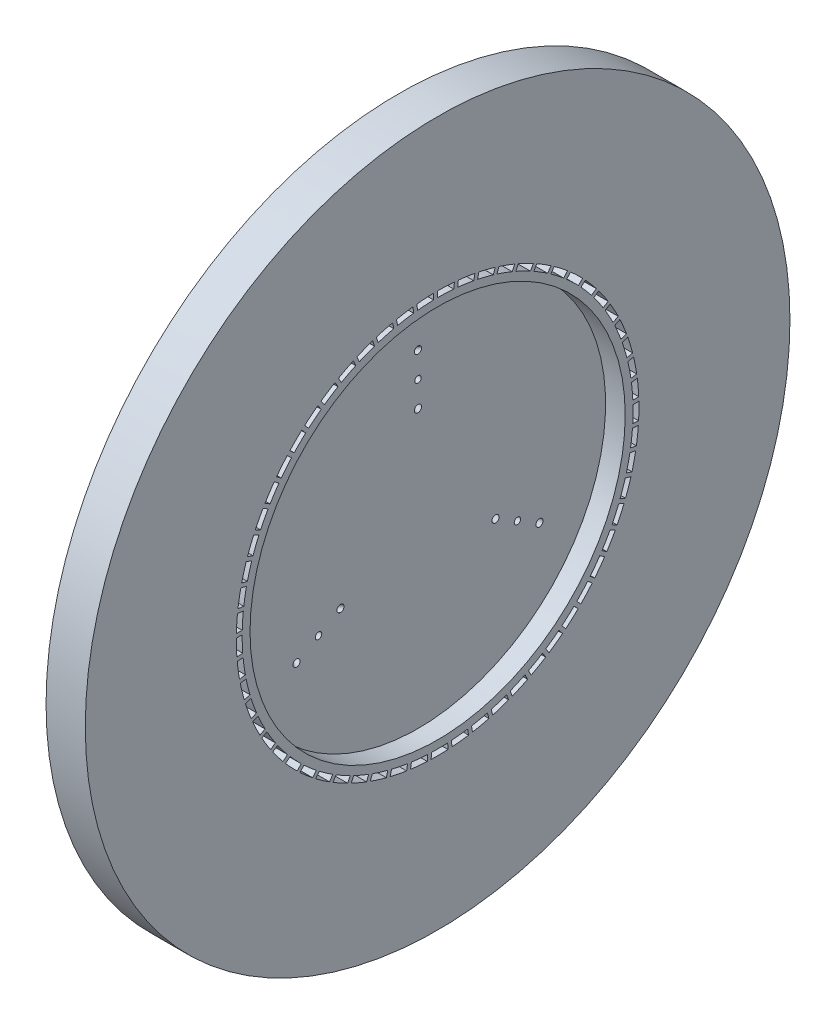
from build123d import *

# Parameters (mm, degrees)
SKETCH1_R                                = 89.825
SKETCH1_R_2                              = 47.825
FLANGE_DEPTH                             = 10
REGEN_SLOTS_DEPTH                        = 25
FACEPLATE_EXTRUSION_TO_MANIFOLD_SKETCH_R = 47.825
FACEPLATE_EXTRUSION_TO_MANIFOLD_DEPTH    = 5
FACEPLATE_START                          = 1
FACEPLATE_EXTRUSION_TO_CHAMBER_SKETCH_R  = 47.825
FACEPLATE_EXTRUSION_TO_CHAMBER_DEPTH     = 1
O_RING_SLOT_SKETCH_R                     = 47.825
O_RING_SLOT_SKETCH_R_2                   = 44.825
O_RING_SLOT_DEPTH                        = 2.5
FUEL_ORIFICES_SKETCH_R                   = 0.826210335
FUEL_ORIFICES_DEPTH                      = 128.507102743
OX1_PROFILE_R                            = 0.914623685
REVOLVE_OX_ORIFICE_1_COUNT               = 3
OX2_PROFILE_R                            = 0.914623685
REVOLVE_OX_ORIFICE_2_COUNT               = 3


with BuildPart() as part:
    # Sketch1 → Flange (new body)
    with BuildSketch(Plane(origin=(0, 0, 0), x_dir=(0, 0, -1), z_dir=(1, 0, 0))):
        Circle(SKETCH1_R)
        Circle(SKETCH1_R_2, mode=Mode.SUBTRACT)
    extrude(amount=FLANGE_DEPTH)

    # Regen Slots Sketch → Regen Slots (cut)
    with BuildSketch(Plane(origin=(10, 0, 0), x_dir=(0, 0, -1), z_dir=(1, 0, 0))):
        with BuildLine():
            ThreePointArc((-19.952615849, 45.655489766), (-18.042869594, 46.443357779), (-16.102104764, 47.15138224))
            Line((-16.102104764, 47.15138224), (-16.55836623, 48.580614784))
            ThreePointArc((-16.55836623, 48.580614784), (-18.57202224, 47.847002152), (-20.553296708, 47.029965123))
            Line((-20.553296708, 47.029965123), (-19.952615849, 45.655489766))
        make_face()
        with BuildLine():
            ThreePointArc((-15.152521521, 47.465057849), (-13.171887784, 48.052388049), (-11.168609468, 48.557108517))
            Line((-11.168609468, 48.557108517), (-11.475497576, 50.02567921))
            ThreePointArc((-11.475497576, 50.02567921), (-13.553911741, 49.503000934), (-15.608693769, 48.89401092))
            Line((-15.608693769, 48.89401092), (-15.152521521, 47.465057849))
        make_face()
        with BuildLine():
            ThreePointArc((-10.191806695, 48.77148451), (-8.161280686, 49.152051051), (-6.116724133, 49.448117364))
            Line((-6.116724133, 49.448117364), (-6.270985793, 50.940458991))
            ThreePointArc((-6.270985793, 50.940458991), (-8.392126406, 50.634255592), (-10.498634794, 50.239768038))
            Line((-10.498634794, 50.239768038), (-10.191806695, 48.77148451))
        make_face()
        with BuildLine():
            ThreePointArc((-5.123056182, 49.560921302), (-3.064161983, 49.730690085), (-1, 49.814963866))
            Line((-1, 49.814963866), (-1, 51.315257234))
            ThreePointArc((-1, 51.315257234), (-3.141382443, 51.228774545), (-5.277287678, 51.052971116))
            Line((-5.277287678, 51.052971116), (-5.123056182, 49.560921302))
        make_face()
        with BuildLine():
            Line((0, 51.325), (0, 49.825))
            ThreePointArc((0, 49.825), (2.065437599, 49.782171432), (4.127324381, 49.653759359))
            Line((4.127324381, 49.653759359), (4.281586042, 51.146100985))
            ThreePointArc((4.281586042, 51.146100985), (2.142660956, 51.280255743), (0, 51.325))
        make_face()
        with BuildLine():
            Line((5.277287678, 51.052971116), (5.123056182, 49.560921302))
            ThreePointArc((5.123056182, 49.560921302), (7.17314303, 49.305949378), (9.210898098, 48.966212649))
            Line((9.210898098, 48.966212649), (9.517786206, 50.434783342))
            ThreePointArc((9.517786206, 50.434783342), (7.403991615, 50.788153473), (5.277287678, 51.052971116))
        make_face()
        with BuildLine():
            Line((10.498634794, 50.239768038), (10.191806695, 48.77148451))
            ThreePointArc((10.191806695, 48.77148451), (12.204811359, 48.307071995), (14.196834003, 47.759611905))
            Line((14.196834003, 47.759611905), (14.653095469, 49.188844449))
            ThreePointArc((14.653095469, 49.188844449), (12.586838122, 49.757684141), (10.498634794, 50.239768038))
        make_face()
        with BuildLine():
            Line((15.608693769, 48.89401092), (15.152521521, 47.465057849))
            ThreePointArc((15.152521521, 47.465057849), (17.107105652, 46.79612763), (19.032279936, 46.046747393))
            Line((19.032279936, 46.046747393), (19.633078274, 47.421491567))
            ThreePointArc((19.633078274, 47.421491567), (17.636261013, 48.19977098), (15.608693769, 48.89401092))
        make_face()
        with BuildLine():
            Line((20.553296708, 47.029965123), (19.952615849, 45.655489766))
            ThreePointArc((19.952615849, 45.655489766), (21.828060369, 44.789132672), (23.665978967, 43.845775903))
            Line((23.665978967, 43.845775903), (24.404945566, 45.151459078))
            ThreePointArc((24.404945566, 45.151459078), (22.498735149, 46.130928255), (20.553296708, 47.029965123))
        make_face()
        with BuildLine():
            Line((25.280029588, 44.667389996), (24.541207486, 43.361962134))
            ThreePointArc((24.541207486, 43.361962134), (26.317632217, 42.307361765), (28.048812733, 41.180028282))
            Line((28.048812733, 41.180028282), (28.918114364, 42.402809891))
            ThreePointArc((28.918114364, 42.402809891), (27.122717097, 43.573086215), (25.280029588, 44.667389996))
        make_face()
        with BuildLine():
            Line((29.738787865, 41.831329423), (28.869656218, 40.608786917))
            ThreePointArc((28.869656218, 40.608786917), (30.528230615, 39.377122298), (32.134322107, 38.077762116))
            Line((32.134322107, 38.077762116), (33.124743955, 39.20468037))
            ThreePointArc((33.124743955, 39.20468037), (31.459191495, 40.553358621), (29.738787865, 41.831329423))
        make_face()
        with BuildLine():
            Line((33.882307593, 38.551846352), (32.892079412, 37.425148456))
            ThreePointArc((32.892079412, 37.425148456), (34.415222175, 36.02947554), (35.879199672, 34.571862199))
            Line((35.879199672, 34.571862199), (36.98024302, 35.590971484))
            ThreePointArc((36.98024302, 35.590971484), (35.462190638, 37.103755338), (33.882307593, 38.551846352))
        make_face()
        with BuildLine():
            Line((37.666666432, 34.863704119), (36.565838382, 33.844794111))
            ThreePointArc((36.565838382, 33.844794111), (37.937403818, 32.299907377), (39.243748795, 30.699491942))
            Line((39.243748795, 30.699491942), (40.443742309, 31.599989447))
            ThreePointArc((40.443742309, 31.599989447), (39.089281738, 33.260843017), (37.666666432, 34.863704119))
        make_face()
        with BuildLine():
            Line((41.051749236, 30.805997949), (39.851990369, 29.905676528))
            ThreePointArc((39.851990369, 29.905676528), (41.057439543, 28.227952161), (42.192304418, 26.501699434))
            Line((42.192304418, 26.501699434), (43.478527869, 27.27403966))
            ThreePointArc((43.478527869, 27.27403966), (42.302016727, 29.065357486), (41.051749236, 30.805997949))
        make_face()
        with BuildLine():
            Line((44.001673286, 26.421740537), (42.715701344, 25.649551335))
            ThreePointArc((42.715701344, 25.649551335), (43.742256194, 23.85677363), (44.693611118, 22.022982319))
            Line((44.693611118, 22.022982319), (46.052430217, 22.658978268))
            ThreePointArc((46.052430217, 22.658978268), (45.066339816, 24.561771935), (44.001673286, 26.421740537))
        make_face()
        with BuildLine():
            Line((46.485168653, 21.757406103), (45.126615258, 21.121534517))
            ThreePointArc((45.126615258, 21.121534517), (45.963394049, 19.232707363), (46.721154422, 17.310816112))
            Line((46.721154422, 17.310816112), (48.138165348, 17.803726069))
            ThreePointArc((48.138165348, 17.803726069), (47.352948491, 19.797825492), (46.485168653, 21.757406103))
        make_face()
        with BuildLine():
            Line((48.475909667, 16.862437752), (47.059175824, 16.369624179))
            ThreePointArc((47.059175824, 16.369624179), (47.697308492, 14.404769614), (48.253441866, 12.415150949))
            Line((48.253441866, 12.415150949), (49.713623951, 12.759749945))
            ThreePointArc((49.713623951, 12.759749945), (49.137604132, 14.824017173), (48.475909667, 16.862437752))
        make_face()
        with BuildLine():
            Line((49.95279398, 11.788723365), (48.49289742, 11.444191752))
            ThreePointArc((48.49289742, 11.444191752), (48.925619599, 9.424137723), (49.274230822, 7.387882096))
            Line((49.274230822, 7.387882096), (50.762105773, 7.580517297))
            ThreePointArc((50.762105773, 7.580517297), (50.401388946, 9.693070584), (49.95279398, 11.788723365))
        make_face()
        with BuildLine():
            Line((50.90016625, 6.590045578), (49.412582239, 6.397448045))
            ThreePointArc((49.412582239, 6.397448045), (49.635306968, 4.343607628), (49.772700674, 2.282299856))
            Line((49.772700674, 2.282299856), (51.272496646, 2.32092928))
            ThreePointArc((51.272496646, 2.32092928), (51.130906498, 4.459375036), (50.90016625, 6.590045578))
        make_face()
        with BuildLine():
            Line((51.307984095, 1.321511668), (49.808481394, 1.282889798))
            ThreePointArc((49.808481394, 1.282889798), (49.820870177, 0.64149807), (49.825, 0))
            ThreePointArc((49.825, 0), (49.804637718, -1.424319751), (49.743567516, -2.847475331))
            Line((49.743567516, -2.847475331), (51.239386299, -2.963261165))
            ThreePointArc((51.239386299, -2.963261165), (51.30359211, -1.482248835), (51.325, 0))
            ThreePointArc((51.325, 0), (51.320745847, 0.660810606), (51.307984095, 1.321511668))
        make_face()
        with BuildLine():
            Line((51.171924545, -3.961030594), (49.676398255, -3.8452674))
            ThreePointArc((49.676398255, -3.8452674), (49.474296322, -5.901239572), (49.187140168, -7.947066571))
            Line((49.187140168, -7.947066571), (50.66312571, -8.216040304))
            ThreePointArc((50.66312571, -8.216040304), (50.961952887, -6.093847961), (51.171924545, -3.961030594))
        make_face()
        with BuildLine():
            Line((50.493429865, -9.201584946), (49.017732937, -8.932663808))
            ThreePointArc((49.017732937, -8.932663808), (48.60530506, -10.956958749), (48.109316898, -12.962416928))
            Line((48.109316898, -12.962416928), (49.549823386, -13.381727372))
            ThreePointArc((49.549823386, -13.381727372), (50.065272674, -11.301508621), (50.493429865, -9.201584946))
        make_face()
        with BuildLine():
            Line((49.279692266, -14.344600209), (47.839467456, -13.925371756))
            ThreePointArc((47.839467456, -13.925371756), (47.221085473, -15.896531437), (46.521522901, -17.840362441))
            Line((46.521522901, -17.840362441), (47.911280607, -18.405564801))
            ThreePointArc((47.911280607, -18.405564801), (48.637888116, -16.389370478), (49.279692266, -14.344600209))
        make_face()
        with BuildLine():
            Line((47.543577671, -19.335559141), (46.154091718, -18.7704673))
            ThreePointArc((46.154091718, -18.7704673), (45.336310633, -20.667596938), (44.440589187, -22.529195674))
            Line((44.440589187, -22.529195674), (45.764866334, -23.234298664))
            ThreePointArc((45.764866334, -23.234298664), (46.694929844, -21.30350093), (47.543577671, -19.335559141))
        make_face()
        with BuildLine():
            Line((45.303489324, -24.121556336), (43.979471127, -23.416591221))
            ThreePointArc((43.979471127, -23.416591221), (42.970959622, -25.219580769), (41.888574173, -26.979213828))
            Line((41.888574173, -26.979213828), (43.133333094, -27.816743182))
            ThreePointArc((43.133333094, -27.816743182), (44.256993699, -25.991808973), (45.303489324, -24.121556336))
        make_face()
        with BuildLine():
            Line((42.583172721, -28.651859033), (41.3386572, -27.81449345))
            ThreePointArc((41.3386572, -27.81449345), (40.150105749, -29.50423077), (38.892529852, -31.143245604))
            Line((38.892529852, -31.143245604), (40.044575792, -32.104323301))
            ThreePointArc((40.044575792, -32.104323301), (41.349922412, -30.404597375), (42.583172721, -28.651859033))
        make_face()
        with BuildLine():
            Line((39.411463893, -32.878444897), (38.259643224, -31.917555129))
            ThreePointArc((38.259643224, -31.917555129), (36.903650767, -33.476128585), (35.484215039, -34.977151229))
            Line((35.484215039, -34.977151229), (36.531336025, -36.051589607))
            ThreePointArc((36.531336025, -36.051589607), (38.00453166, -34.495089481), (39.411463893, -32.878444897))
        make_face()
        with BuildLine():
            Line((35.821983743, -36.756511065), (34.775067511, -35.682282783))
            ThreePointArc((34.775067511, -35.682282783), (33.266007906, -37.09317111), (31.699758719, -38.44029035))
            Line((31.699758719, -38.44029035), (32.630855008, -39.616700095))
            ThreePointArc((32.630855008, -39.616700095), (34.256283418, -38.219925057), (35.821983743, -36.756511065))
        make_face()
        with BuildLine():
            Line((31.852781655, -40.244949073), (30.921867432, -39.068769363))
            ThreePointArc((30.921867432, -39.068769363), (29.275737086, -40.317016793), (27.579277071, -41.49595283))
            Line((27.579277071, -41.49595283), (28.384478811, -42.761863706))
            ThreePointArc((28.384478811, -42.761863706), (30.14491005, -41.53961992), (31.852781655, -40.244949073))
        make_face()
        with BuildLine():
            Line((27.545932157, -43.306780608), (26.740887866, -42.041117268))
            ThreePointArc((26.740887866, -42.041117268), (24.97513617, -43.113492068), (23.166448225, -44.111747887))
            Line((23.166448225, -44.111747887), (23.837220077, -45.453740924))
            ThreePointArc((23.837220077, -45.453740924), (25.713993136, -44.418984477), (27.545932157, -43.306780608))
        make_face()
        with BuildLine():
            Line((22.947088925, -45.909549495), (22.276448235, -44.567818872))
            ThreePointArc((22.276448235, -44.567818872), (20.409792597, -45.452953602), (18.508049264, -46.259947443))
            Line((18.508049264, -46.259947443), (19.03728088, -47.663797181))
            ThreePointArc((19.03728088, -47.663797181), (21.010501499, -46.827496749), (22.947088925, -45.909549495))
        make_face()
        with BuildLine():
            Line((18.105000842, -48.025665737), (17.575872712, -46.622090509))
            ThreePointArc((17.575872712, -46.622090509), (15.628100145, -47.31060252), (13.653460377, -47.917780048))
            Line((13.653460377, -47.917780048), (14.03554177, -49.36860533))
            ThreePointArc((14.03554177, -49.36860533), (16.084293318, -48.739625906), (18.105000842, -48.025665737))
        make_face()
        with BuildLine():
            Line((13.070995246, -49.632697975), (12.688988566, -48.182156388))
            ThreePointArc((12.688988566, -48.182156388), (10.680745944, -48.666747283), (8.654141414, -49.067672264))
            Line((8.654141414, -49.067672264), (8.885022426, -50.550093981))
            ThreePointArc((8.885022426, -50.550093981), (10.987587627, -50.135102903), (13.070995246, -49.632697975))
        make_face()
        with BuildLine():
            Line((7.898433849, -50.713611267), (7.667597984, -49.231479423))
            ThreePointArc((7.667597984, -49.231479423), (5.620173179, -49.507012417), (3.563086399, -49.697434947))
            Line((3.563086399, -49.697434947), (3.640319633, -51.195739061))
            ThreePointArc((3.640319633, -51.195739061), (5.774410774, -50.999135338), (7.898433849, -50.713611267))
        make_face()
        with BuildLine():
            Line((2.642147089, -51.256947663), (2.564928956, -49.758936529))
            ThreePointArc((2.564928956, -49.758936529), (0.50002518, -49.822490903), (-1.565738219, -49.800392457))
            Line((-1.565738219, -49.800392457), (-1.642971453, -51.29869657))
            ThreePointArc((-1.642971453, -51.29869657), (0.50002373, -51.322564251), (2.642147089, -51.256947663))
        make_face()
        with BuildLine():
            ThreePointArc((-2.564928956, -49.758936529), (-4.62542321, -49.609838592), (-6.677965622, -49.375453417))
            Line((-6.677965622, -49.375453417), (-6.908846633, -50.857875135))
            ThreePointArc((-6.908846633, -50.857875135), (-4.77966369, -51.101961215), (-2.642147089, -51.256947663))
            Line((-2.642147089, -51.256947663), (-2.564928956, -49.758936529))
        make_face()
        with BuildLine():
            ThreePointArc((-7.667597984, -49.231479423), (-9.701840963, -48.87130965), (-11.719404928, -48.427122288))
            Line((-11.719404928, -48.427122288), (-12.10148632, -49.87794757))
            ThreePointArc((-12.10148632, -49.87794757), (-10.008685486, -50.339664678), (-7.898433849, -50.713611267))
            Line((-7.898433849, -50.713611267), (-7.667597984, -49.231479423))
        make_face()
        with BuildLine():
            ThreePointArc((-12.688988566, -48.182156388), (-14.675416789, -47.614732668), (-16.636615626, -46.965451616))
            Line((-16.636615626, -46.965451616), (-17.165847242, -48.369301354))
            ThreePointArc((-17.165847242, -48.369301354), (-15.131612725, -49.043755172), (-13.070995246, -49.632697975))
            Line((-13.070995246, -49.632697975), (-12.688988566, -48.182156388))
        make_face()
        with BuildLine():
            ThreePointArc((-17.575872712, -46.622090509), (-19.493429546, -45.853427675), (-21.37747406, -45.005935473))
            Line((-21.37747406, -45.005935473), (-22.048245913, -46.34792851))
            ThreePointArc((-22.048245913, -46.34792851), (-20.094141106, -47.22796966), (-18.105000842, -48.025665737))
            Line((-18.105000842, -48.025665737), (-17.575872712, -46.622090509))
        make_face()
        with BuildLine():
            ThreePointArc((-22.276448235, -44.567818872), (-24.104807101, -43.606064941), (-25.891725951, -42.569345218))
            Line((-25.891725951, -42.569345218), (-26.696927691, -43.835256094))
            ThreePointArc((-26.696927691, -43.835256094), (-24.843666592, -44.911555921), (-22.947088925, -45.909549495))
            Line((-22.947088925, -45.909549495), (-22.276448235, -44.567818872))
        make_face()
        with BuildLine():
            ThreePointArc((-26.740887866, -42.041117268), (-28.460667703, -40.896467071), (-30.131519106, -39.681509313))
            Line((-30.131519106, -39.681509313), (-31.062615395, -40.857919059))
            ThreePointArc((-31.062615395, -40.857919059), (-29.329843032, -42.119068517), (-27.545932157, -43.306780608))
            Line((-27.545932157, -43.306780608), (-26.740887866, -42.041117268))
        make_face()
        with BuildLine():
            ThreePointArc((-30.921867432, -39.068769363), (-32.514838148, -37.753356476), (-34.051910662, -36.373039538))
            Line((-34.051910662, -36.373039538), (-35.099031649, -37.447477917))
            ThreePointArc((-35.099031649, -37.447477917), (-33.505115839, -38.880108508), (-31.852781655, -40.244949073))
            Line((-31.852781655, -40.244949073), (-30.921867432, -39.068769363))
        make_face()
        with BuildLine():
            ThreePointArc((-34.775067511, -35.682282783), (-36.224343219, -34.210050911), (-37.611343494, -32.679006496))
            Line((-37.611343494, -32.679006496), (-38.763389435, -33.640084193))
            ThreePointArc((-38.763389435, -33.640084193), (-37.325226083, -35.229009678), (-35.821983743, -36.756511065))
            Line((-35.821983743, -36.756511065), (-34.775067511, -35.682282783))
        make_face()
        with BuildLine():
            ThreePointArc((-38.259643224, -31.917555129), (-39.549861241, -30.304110295), (-40.772086729, -28.638567855))
            Line((-40.772086729, -28.638567855), (-42.01684565, -29.476097209))
            ThreePointArc((-42.01684565, -29.476097209), (-40.749679645, -31.20447458), (-39.411463893, -32.878444897))
            Line((-39.411463893, -32.878444897), (-38.259643224, -31.917555129))
        make_face()
        with BuildLine():
            ThreePointArc((-41.3386572, -27.81449345), (-42.456140895, -26.076938572), (-43.500635701, -24.29455327))
            Line((-43.500635701, -24.29455327), (-44.824912848, -24.999656261))
            ThreePointArc((-44.824912848, -24.999656261), (-43.742176466, -26.849164289), (-42.583172721, -28.651859033))
            Line((-42.583172721, -28.651859033), (-41.3386572, -27.81449345))
        make_face()
        with BuildLine():
            ThreePointArc((-43.979471127, -23.416591221), (-44.912374894, -21.573344812), (-45.768067113, -19.693010377))
            Line((-45.768067113, -19.693010377), (-47.157824819, -20.258212737))
            ThreePointArc((-47.157824819, -20.258212737), (-46.270995334, -22.209246178), (-45.303489324, -24.121556336))
            Line((-45.303489324, -24.121556336), (-43.979471127, -23.416591221))
        make_face()
        with BuildLine():
            ThreePointArc((-46.154091718, -18.7704673), (-46.892526546, -16.841068231), (-47.550345628, -14.882716675))
            Line((-47.550345628, -14.882716675), (-48.990852116, -15.302027119))
            ThreePointArc((-48.990852116, -15.302027119), (-48.309330141, -17.333904532), (-47.543577671, -19.335559141))
            Line((-47.543577671, -19.335559141), (-46.154091718, -18.7704673))
        make_face()
        with BuildLine():
            ThreePointArc((-47.839467456, -13.925371756), (-48.375605751, -11.930272137), (-48.828578651, -9.914662474))
            Line((-48.828578651, -9.914662474), (-50.304564193, -10.183636207))
            ThreePointArc((-50.304564193, -10.183636207), (-49.835574031, -12.274819185), (-49.279692266, -14.344600209))
            Line((-49.279692266, -14.344600209), (-47.839467456, -13.925371756))
        make_face()
        with BuildLine():
            ThreePointArc((-49.017732937, -8.932663808), (-49.3458915, -6.89301219), (-49.589216592, -4.841510384))
            Line((-49.589216592, -4.841510384), (-51.085035374, -4.957296218))
            ThreePointArc((-51.085035374, -4.957296218), (-50.833548438, -7.085617702), (-50.493429865, -9.201584946))
            Line((-50.493429865, -9.201584946), (-49.017732937, -8.932663808))
        make_face()
        with BuildLine():
            ThreePointArc((-49.676398255, -3.8452674), (-49.793098524, -1.7826846), (-49.824196501, 0.282962921))
            Line((-49.824196501, 0.282962921), (-51.323992473, 0.321592345))
            ThreePointArc((-51.323992473, 0.321592345), (-51.292674586, -1.821306909), (-51.171924545, -3.961030594))
            Line((-51.171924545, -3.961030594), (-49.676398255, -3.8452674))
        make_face()
        with BuildLine():
            ThreePointArc((-49.808481394, 1.282889798), (-49.712486316, 3.346539891), (-49.531027533, 5.404436748))
            Line((-49.531027533, 5.404436748), (-51.018902483, 5.597071949))
            ThreePointArc((-51.018902483, 5.597071949), (-51.208085623, 3.462310191), (-51.307984095, 1.321511668))
            Line((-51.307984095, 1.321511668), (-49.808481394, 1.282889798))
        make_face()
        with BuildLine():
            ThreePointArc((-49.412582239, 6.397448045), (-49.104909387, 8.440290227), (-48.71281735, 10.468622201))
            Line((-48.71281735, 10.468622201), (-50.172999435, 10.813221197))
            ThreePointArc((-50.172999435, 10.813221197), (-50.580678213, 8.709225942), (-50.90016625, 6.590045578))
            Line((-50.90016625, 6.590045578), (-49.412582239, 6.397448045))
        make_face()
        with BuildLine():
            ThreePointArc((-48.49289742, 11.444191752), (-47.976808202, 13.444571386), (-47.378239186, 15.421837655))
            Line((-47.378239186, 15.421837655), (-48.795250112, 15.914747611))
            ThreePointArc((-48.795250112, 15.914747611), (-49.417103031, 13.863821731), (-49.95279398, 11.788723365))
            Line((-49.95279398, 11.788723365), (-48.49289742, 11.444191752))
        make_face()
        with BuildLine():
            ThreePointArc((-47.059175824, 16.369624179), (-46.340140915, 18.306336744), (-45.5414399, 20.211577793))
            Line((-45.5414399, 20.211577793), (-46.900258998, 20.847573741))
            ThreePointArc((-46.900258998, 20.847573741), (-47.729694264, 18.871457561), (-48.475909667, 16.862437752))
            Line((-48.475909667, 16.862437752), (-47.059175824, 16.369624179))
        make_face()
        with BuildLine():
            ThreePointArc((-45.126615258, 21.121534517), (-44.212256606, 22.974050379), (-43.221890021, 24.787070178))
            Line((-43.221890021, 24.787070178), (-44.508113472, 25.559410404))
            ThreePointArc((-44.508113472, 25.559410404), (-45.536338864, 23.679051245), (-46.485168653, 21.757406103))
            Line((-46.485168653, 21.757406103), (-45.126615258, 21.121534517))
        make_face()
        with BuildLine():
            ThreePointArc((-39.851990369, 29.905676528), (-38.578029257, 31.53198826), (-37.23774635, 33.104091466))
            Line((-37.23774635, 33.104091466), (-38.338789698, 34.123200751))
            ThreePointArc((-38.338789698, 34.123200751), (-39.729905319, 32.492926128), (-41.051749236, 30.805997949))
            Line((-41.051749236, 30.805997949), (-39.851990369, 29.905676528))
        make_face()
        with BuildLine():
            ThreePointArc((-36.565838382, 33.844794111), (-35.131410429, 35.331496236), (-33.636585968, 36.757457874))
            Line((-33.636585968, 36.757457874), (-34.627007817, 37.884376129))
            ThreePointArc((-34.627007817, 37.884376129), (-36.178376815, 36.405778059), (-37.666666432, 34.863704119))
            Line((-37.666666432, 34.863704119), (-36.565838382, 33.844794111))
        make_face()
        with BuildLine():
            ThreePointArc((-32.892079412, 37.425148456), (-31.312389911, 38.756481562), (-29.678869408, 40.021186085))
            Line((-29.678869408, 40.021186085), (-30.548171039, 41.243967695))
            ThreePointArc((-30.548171039, 41.243967695), (-32.243348516, 39.932719685), (-33.882307593, 38.551846352))
            Line((-33.882307593, 38.551846352), (-32.892079412, 37.425148456))
        make_face()
        with BuildLine():
            ThreePointArc((-28.869656218, 40.608786917), (-27.16145027, 41.770638543), (-25.406549449, 42.860679767))
            Line((-25.406549449, 42.860679767), (-26.145516048, 44.166362943))
            ThreePointArc((-26.145516048, 44.166362943), (-27.966532702, 43.03636455), (-29.738787865, 41.831329423))
            Line((-29.738787865, 41.831329423), (-28.869656218, 40.608786917))
        make_face()
        with BuildLine():
            ThreePointArc((-24.541207486, 43.361962134), (-22.722592499, 44.342016363), (-20.864913745, 45.245839581))
            Line((-20.864913745, 45.245839581), (-21.465712083, 46.620583756))
            ThreePointArc((-21.465712083, 46.620583756), (-23.393264684, 45.683813243), (-25.280029588, 44.667389996))
            Line((-25.280029588, 44.667389996), (-24.541207486, 43.361962134))
        make_face()
        with BuildLine():
            ThreePointArc((-42.715701344, 25.649551335), (-41.615711378, 27.398233364), (-40.444177356, 29.099813453))
            Line((-40.444177356, 29.099813453), (-41.64417087, 30.000310957))
            ThreePointArc((-41.64417087, 30.000310957), (-42.860286943, 28.235641096), (-44.001673286, 26.421740537))
            Line((-44.001673286, 26.421740537), (-42.715701344, 25.649551335))
        make_face()
    extrude(amount=-REGEN_SLOTS_DEPTH, mode=Mode.SUBTRACT)



with BuildPart() as body_2:
    # Faceplate Extrusion to Manifold Sketch → Faceplate Extrusion to Manifold (new body)
    with BuildSketch(Plane.ZY):
        with Locations(Location((0, 0, 0), (0, 0, 180))):
            Circle(FACEPLATE_EXTRUSION_TO_MANIFOLD_SKETCH_R)
    extrude(amount=-FACEPLATE_EXTRUSION_TO_MANIFOLD_DEPTH)


with BuildPart() as part_1:
    add(part.part)

    add(body_2.part)  # Faceplate Extrusion to Chamber merges body 2
    # Faceplate Extrusion to Chamber Sketch → Faceplate Extrusion to Chamber (add)
    with BuildSketch(Plane.ZY.offset(FACEPLATE_START)):
        Circle(FACEPLATE_EXTRUSION_TO_CHAMBER_SKETCH_R)
    extrude(amount=-FACEPLATE_EXTRUSION_TO_CHAMBER_DEPTH)

    # O-Ring Slot Sketch → O-Ring Slot (cut)
    with BuildSketch(Plane.ZY.offset(1)):
        Circle(O_RING_SLOT_SKETCH_R)
        Circle(O_RING_SLOT_SKETCH_R_2, mode=Mode.SUBTRACT)
    extrude(amount=-O_RING_SLOT_DEPTH, mode=Mode.SUBTRACT)

    # Fuel Orifices Sketch → Fuel Orifices (cut, through all)
    with BuildSketch(Plane.ZY.offset(1)):
        with Locations((0, 29.2826)):
            Circle(FUEL_ORIFICES_SKETCH_R)
        with Locations((25.359475489, -14.6413)):
            Circle(FUEL_ORIFICES_SKETCH_R)
        with Locations((-25.359475489, -14.6413)):
            Circle(FUEL_ORIFICES_SKETCH_R)
    extrude(amount=-FUEL_ORIFICES_DEPTH, mode=Mode.SUBTRACT)

    # Ox1 Orifice 1: sweep along a path in Ox1 Guide Curve
    with BuildLine(Plane(origin=(0, 0, 0), x_dir=(1, 0, 0), z_dir=(0, 0.8660254037844388, 0.49999999999999983))) as ox1_orifice_1_path:
        Line((-1, -32.2826), (5, -35.746701615))
    # Ox1 Profile → Ox1 Orifice 1 (sweep, cut)
    with BuildSketch(Plane.ZY.offset(1)):
        with Locations((27.9575517, -16.1413)):
            Circle(OX1_PROFILE_R)
    ox1_orifice_1 = sweep(path=ox1_orifice_1_path.line, mode=Mode.SUBTRACT)

    # Revolve Ox Orifice 1: Ox1 Orifice 1 ×3 about axis
    revolve_ox_orifice_1_axis = Axis((5, 0, 0), (-1, 0, 0))
    for i in range(1, REVOLVE_OX_ORIFICE_1_COUNT):
        add(ox1_orifice_1.rotate(revolve_ox_orifice_1_axis, i * 360 / REVOLVE_OX_ORIFICE_1_COUNT), mode=Mode.SUBTRACT)

    # Ox Orifice 2: sweep along a path in Ox2 Guide Curve
    with BuildLine(Plane(origin=(0, 0, 0), x_dir=(1, 0, 0), z_dir=(0, 0.8660254037844388, 0.49999999999999983))) as ox_orifice_2_path:
        Line((-1, -26.2826), (5, -22.818498385))
    # Ox2 Profile → Ox Orifice 2 (sweep, cut)
    with BuildSketch(Plane.ZY.offset(1)):
        with Locations((22.761399278, -13.1413)):
            Circle(OX2_PROFILE_R)
    ox_orifice_2 = sweep(path=ox_orifice_2_path.line, mode=Mode.SUBTRACT)

    # Revolve Ox Orifice 2: Ox Orifice 2 ×3 about axis
    revolve_ox_orifice_2_axis = Axis((5, 0, 0), (-1, 0, 0))
    for i in range(1, REVOLVE_OX_ORIFICE_2_COUNT):
        add(ox_orifice_2.rotate(revolve_ox_orifice_2_axis, i * 360 / REVOLVE_OX_ORIFICE_2_COUNT), mode=Mode.SUBTRACT)


solid = part_1.part
